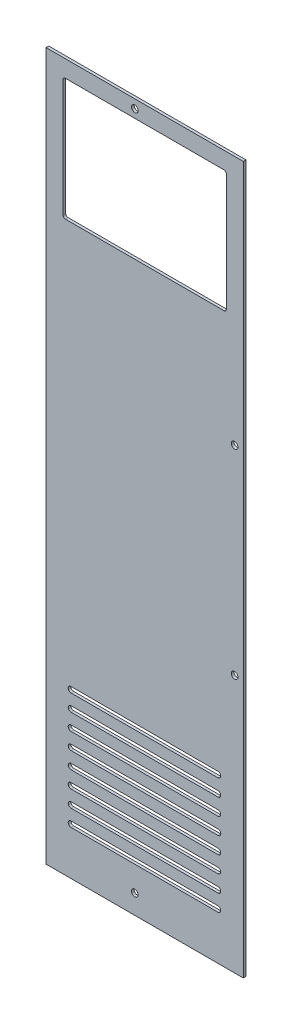
from build123d import *

# Parameters (mm, degrees)
SKETCH1_W           = 225.9076
SKETCH1_H           = 810.1076
BOSS_EXTRUDE1_DEPTH = 3.0734
VENTMASTER_DEPTH    = 421.519425968
LPATTERN1_COUNT     = 8
LPATTERN1_PITCH     = 19.05
CUT_EXTRUDE2_DEPTH  = 3.0734
SKETCH4_R           = 3.81
CUT_EXTRUDE3_DEPTH  = 421.519425968


# Read off the part's stored shape, not the designer's step: Cut-Extrude2
with BuildPart() as part:
    # Sketch1 → Boss-Extrude1 (new body)
    with BuildSketch(Plane.XY):
        Rectangle(SKETCH1_W, SKETCH1_H)
    extrude(amount=BOSS_EXTRUDE1_DEPTH)

    # Sketch2 → VentMaster (cut, through all)
    with BuildSketch(Plane.XY.offset(3.0734)):
        with BuildLine():
            Line((-84.3788, -347.9038), (83.9978, -347.9038))
            ThreePointArc((83.9978, -347.9038), (87.1728, -351.0788), (83.9978, -354.2538))
            Line((83.9978, -354.2538), (-84.3788, -354.2538))
            ThreePointArc((-84.3788, -354.2538), (-87.5538, -351.0788), (-84.3788, -347.9038))
        make_face()
    ventmaster = extrude(amount=-VENTMASTER_DEPTH, mode=Mode.SUBTRACT)

    # LPattern1: VentMaster ×8
    with Locations(*[(0, i * LPATTERN1_PITCH, 0) for i in range(1, LPATTERN1_COUNT)]):
        add(ventmaster, mode=Mode.SUBTRACT)

    # Cut-Extrude2 outline → Cut-Extrude2 (cut)
    with BuildSketch(Plane.XY):
        with BuildLine():
            Line((-93.5228, 383.0828), (-93.5228, 248.4628))
            ThreePointArc((-93.5228, 248.4628), (-92.778851224, 246.666748776), (-90.9828, 245.9228))
            Line((-90.9828, 245.9228), (90.9828, 245.9228))
            ThreePointArc((90.9828, 245.9228), (92.778851224, 246.666748776), (93.5228, 248.4628))
            Line((93.5228, 248.4628), (93.5228, 383.0828))
            ThreePointArc((93.5228, 383.0828), (92.778851224, 384.878851224), (90.9828, 385.6228))
            Line((90.9828, 385.6228), (-90.9828, 385.6228))
            ThreePointArc((-90.9828, 385.6228), (-92.778851224, 384.878851224), (-93.5228, 383.0828))
        make_face()
    extrude(amount=CUT_EXTRUDE2_DEPTH, mode=Mode.SUBTRACT)

    # Sketch4 → Cut-Extrude3 (cut, through all)
    with BuildSketch(Plane.XY.offset(3.0734)):
        with Locations((-11.2522, 395.1478)):
            Circle(SKETCH4_R)
        with Locations((-11.2522, -382.8288)):
            Circle(SKETCH4_R)
        with Locations((103.0478, -109.7026)):
            Circle(SKETCH4_R)
        with Locations((103.0478, 118.5418)):
            Circle(SKETCH4_R)
    extrude(amount=-CUT_EXTRUDE3_DEPTH, mode=Mode.SUBTRACT)


solid = part.part
